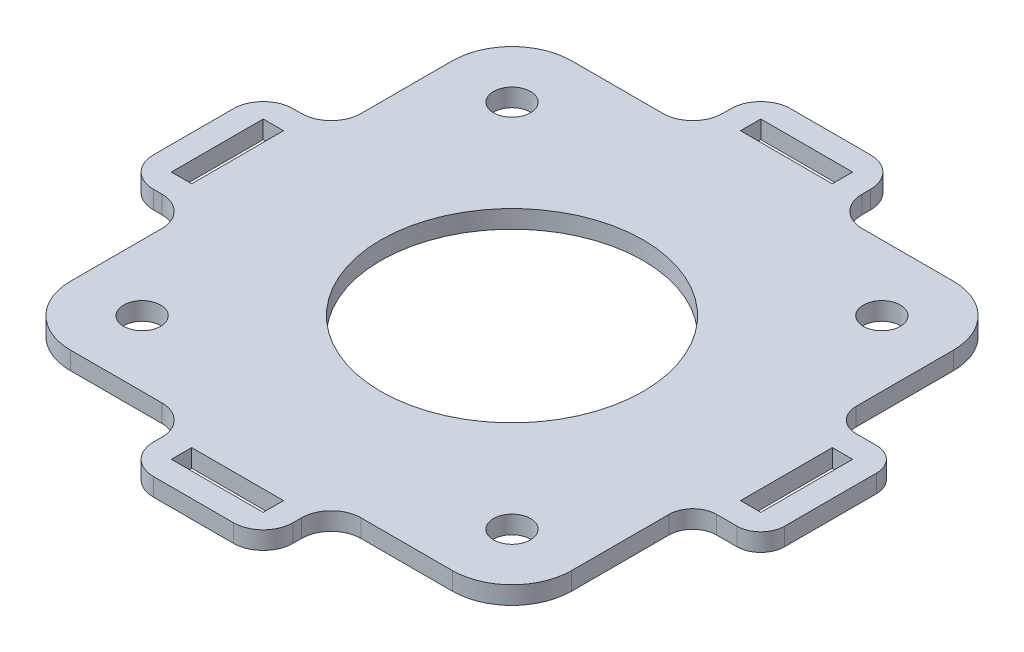
from build123d import *

# Parameters (mm, degrees)
SKETCH1_R           = 1.55
SKETCH1_R_2         = 11
SKETCH1_W           = 7.7
SKETCH1_H           = 1.7
SKETCH1_W_2         = 1.7
SKETCH1_H_2         = 7.7
BOSS_EXTRUDE1_DEPTH = 1.5
FILLET2_R           = 5
FILLET3_R           = 2
FILLET1_R           = 2.5


with BuildPart() as part:
    # Sketch1 → Boss-Extrude1 (new body)
    with BuildSketch(Plane(origin=(0, 0, 0), x_dir=(1, 0, 0), z_dir=(0, 1, 0))):
        Polygon((21, 5.85), (26.7, 5.85), (26.7, -5.85), (21, -5.85), (21, -21), (5.85, -21), (5.85, -26.7), (-5.85, -26.7), (-5.85, -21), (-21, -21), (-21, -5.85), (-26.7, -5.85), (-26.7, 5.85), (-21, 5.85), (-21, 21), (-5.85, 21), (-5.85, 26.7), (5.85, 26.7), (5.85, 21), (21, 21), align=None)
        with Locations((-15.5, 15.5)):
            Circle(SKETCH1_R, mode=Mode.SUBTRACT)
        with Locations((15.5, 15.5)):
            Circle(SKETCH1_R, mode=Mode.SUBTRACT)
        with Locations((15.5, -15.5)):
            Circle(SKETCH1_R, mode=Mode.SUBTRACT)
        with Locations((-15.5, -15.5)):
            Circle(SKETCH1_R, mode=Mode.SUBTRACT)
        Circle(SKETCH1_R_2, mode=Mode.SUBTRACT)
        with Locations((0, -23.85)):
            Rectangle(SKETCH1_W, SKETCH1_H, mode=Mode.SUBTRACT)
        with Locations((23.85, 0)):
            Rectangle(SKETCH1_W_2, SKETCH1_H_2, mode=Mode.SUBTRACT)
        with Locations((-23.85, 0)):
            Rectangle(SKETCH1_W_2, SKETCH1_H_2, mode=Mode.SUBTRACT)
        with Locations((0, 23.85)):
            Rectangle(SKETCH1_W, SKETCH1_H, mode=Mode.SUBTRACT)
    extrude(amount=BOSS_EXTRUDE1_DEPTH)

    # Fillet2
    fillet2_edges = [part.edges().sort_by_distance(p)[0] for p in [
        (21, 0.75, 21),
        (-21, 0.75, 21),
        (-21, 0.75, -21),
        (21, 0.75, -21),
    ]]
    fillet(fillet2_edges, radius=FILLET2_R)

    # Fillet3
    fillet3_edges = [part.edges().sort_by_distance(p)[0] for p in [
        (26.7, 0.75, -5.85),
        (21, 0.75, -5.85),
        (21, 0.75, 5.85),
        (26.7, 0.75, 5.85),
    ]]
    fillet(fillet3_edges, radius=FILLET3_R)

    # Fillet1
    fillet1_edges = [part.edges().sort_by_distance(p)[0] for p in [
        (-21, 0.75, -5.85),
        (-26.7, 0.75, -5.85),
        (-21, 0.75, 5.85),
        (-26.7, 0.75, 5.85),
        (-5.85, 0.75, 26.7),
        (-5.85, 0.75, 21),
        (5.85, 0.75, 26.7),
        (5.85, 0.75, 21),
        (5.85, 0.75, -21),
        (5.85, 0.75, -26.7),
        (-5.85, 0.75, -26.7),
        (-5.85, 0.75, -21),
    ]]
    fillet(fillet1_edges, radius=FILLET1_R)


solid = part.part
